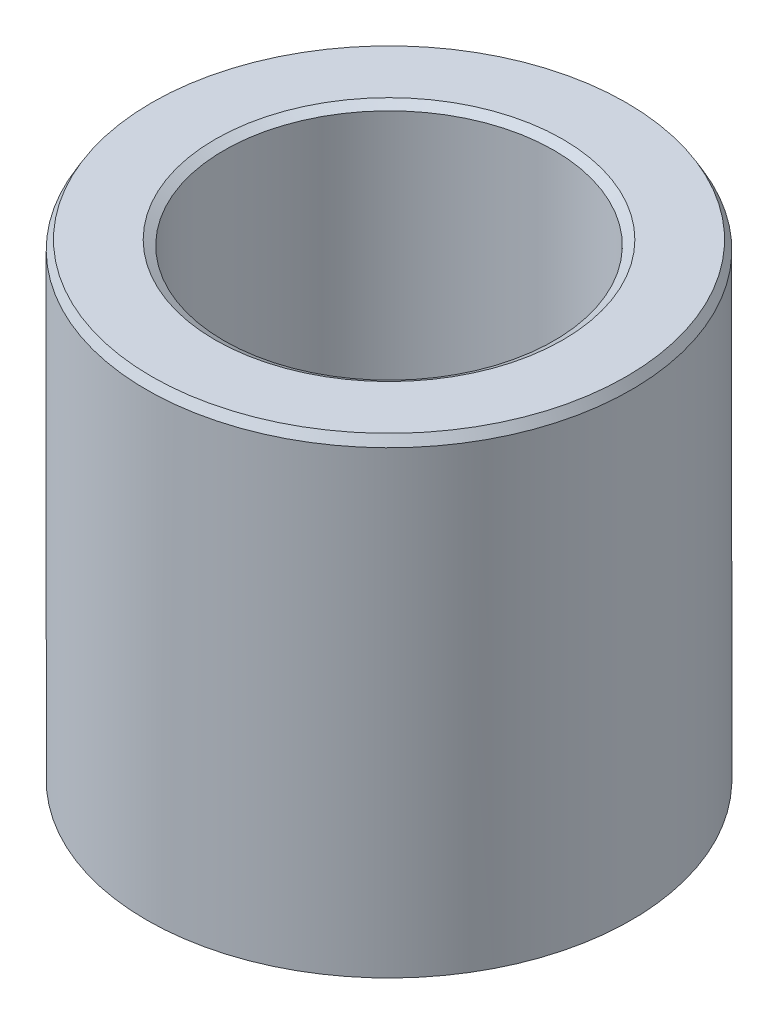
from build123d import *
from OCP.BRepFilletAPI import BRepFilletAPI_MakeChamfer

# Parameters (mm, degrees)
SKETCH1_R           = 60
BOSS_EXTRUDE1_DEPTH = 117.126722497
SKETCH2_R           = 40.835086262
CUT_EXTRUDE1_DEPTH  = 145.632877047
CHAMFER1_SIZE       = 2.195964703
CHAMFER1_SIZE2      = 1.267840812


with BuildPart() as part:
    # Sketch1 → Boss-Extrude1 (new body)
    with BuildSketch(Plane(origin=(0, 0, 0), x_dir=(1, 0, 0), z_dir=(0, 1, 0))):
        Circle(SKETCH1_R)
    extrude(amount=BOSS_EXTRUDE1_DEPTH)

    # Sketch2 → Cut-Extrude1 (cut, through all)
    with BuildSketch(Plane(origin=(0, 0, 0), x_dir=(1, 0, 0), z_dir=(0, 1, 0))):
        Circle(SKETCH2_R)
    extrude(amount=CUT_EXTRUDE1_DEPTH, mode=Mode.SUBTRACT)

    # Chamfer1: one chamfer whose edges measure the first distance from different faces: ONE call of the kernel's chamfer builder (chamfer() names one face for all edges)
    chamfer1_edges_1 = [part.edges().sort_by_distance(p)[0] for p in [
        (-40.835086262, 117.126722497, 0),
    ]]
    chamfer1_side_1 = [part.faces().sort_by_distance(p)[0] for p in [
        (-58.302943725, 117.126722497, 0),
    ]]
    chamfer1_edges_2 = [part.edges().sort_by_distance(p)[0] for p in [
        (-40.835086262, 0, 0),
    ]]
    chamfer1_side_2 = [part.faces().sort_by_distance(p)[0] for p in [
        (-40.835086262, 58.563361249, 0),
    ]]
    chamfer1_edges_3 = [part.edges().sort_by_distance(p)[0] for p in [
        (-60, 0, 0),
    ]]
    chamfer1_side_3 = [part.faces().sort_by_distance(p)[0] for p in [
        (-58.302943725, 0, 0),
    ]]
    chamfer1_edges_4 = [part.edges().sort_by_distance(p)[0] for p in [
        (-60, 117.126722497, 0),
    ]]
    chamfer1_side_4 = [part.faces().sort_by_distance(p)[0] for p in [
        (-60, 58.563361249, 0),
    ]]
    chamfer1 = BRepFilletAPI_MakeChamfer(part.part.solid().wrapped)
    for e in chamfer1_edges_1:
        chamfer1.Add(CHAMFER1_SIZE, CHAMFER1_SIZE2, e.wrapped, chamfer1_side_1[0].wrapped)  # the first distance lies on this face
    for e in chamfer1_edges_2:
        chamfer1.Add(CHAMFER1_SIZE, CHAMFER1_SIZE2, e.wrapped, chamfer1_side_2[0].wrapped)  # the first distance lies on this face
    for e in chamfer1_edges_3:
        chamfer1.Add(CHAMFER1_SIZE, CHAMFER1_SIZE2, e.wrapped, chamfer1_side_3[0].wrapped)  # the first distance lies on this face
    for e in chamfer1_edges_4:
        chamfer1.Add(CHAMFER1_SIZE, CHAMFER1_SIZE2, e.wrapped, chamfer1_side_4[0].wrapped)  # the first distance lies on this face
    add(Compound.cast(chamfer1.Shape()), mode=Mode.REPLACE)


solid = part.part
